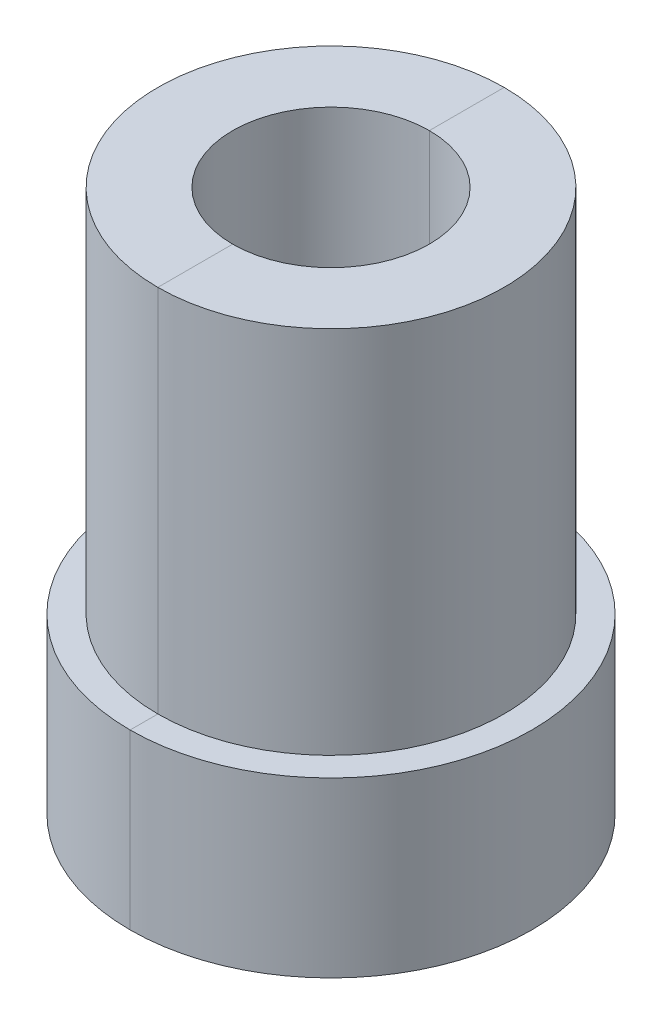
from build123d import *

# Parameters (mm, degrees)
SKETCH1_R           = 5.5245
BOSS_EXTRUDE1_DEPTH = 4.7625
SKETCH2_R           = 4.7625
BOSS_EXTRUDE2_DEPTH = 10.16
SKETCH3_R           = 2.7051
CUT_EXTRUDE1_DEPTH  = 17.844025847


with BuildPart() as part:
    # Sketch1 → Boss-Extrude1 (new body)
    with BuildSketch(Plane(origin=(0, 0, 0), x_dir=(1, 0, 0), z_dir=(0, 1, 0))):
        Circle(SKETCH1_R)
    extrude(amount=BOSS_EXTRUDE1_DEPTH)

    # Sketch2 → Boss-Extrude2 (add)
    with BuildSketch(Plane(origin=(0, 4.7625, 0), x_dir=(1, 0, 0), z_dir=(0, 1, 0))):
        Circle(SKETCH2_R)
    extrude(amount=BOSS_EXTRUDE2_DEPTH)

    # Sketch3 → Cut-Extrude1 (cut, through all)
    with BuildSketch(Plane(origin=(0, 14.9225, 0), x_dir=(1, 0, 0), z_dir=(0, 1, 0))):
        Circle(SKETCH3_R)
    extrude(amount=-CUT_EXTRUDE1_DEPTH, mode=Mode.SUBTRACT)


solid = part.part
